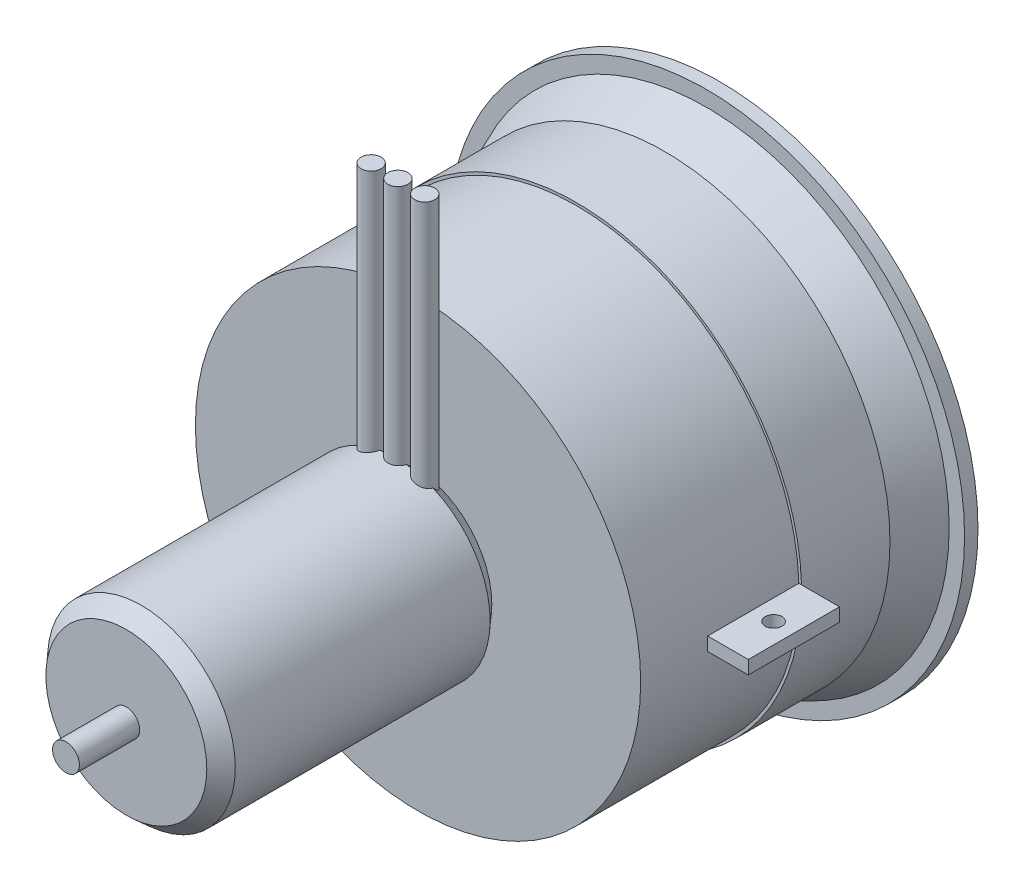
from build123d import *

# Parameters (mm, degrees)
SKETCH3_W           = 2
SKETCH3_H           = 13.6
BOSS_EXTRUDE1_DEPTH = 39.25
SKETCH4_R           = 1.25
CUT_EXTRUDE1_DEPTH  = 113.281176072
SKETCH5_R           = 1.5
BOSS_EXTRUDE5_DEPTH = 50


with BuildPart() as part:
    # Sketch1 → Revolve1 (revolve)
    with BuildSketch(Plane.YZ):
        Polygon((0, 0), (38.5, 0), (38.5, 2), (36.2, 2), (33.6, 8.225), (33.6, 21.4), (33.2, 21.4), (33.2, 45), (5, 45), (5, 46), (12, 46), (14, 48.25), (14, 86.25), (12, 88.5), (2, 88.5), (2, 97.5), (0, 97.5), align=None)
    revolve(axis=Axis((0, 0, 0), (0, 0, -1)))

    # Sketch3 → Boss-Extrude1 (add, symmetric)
    with BuildSketch(Plane.YZ):
        with Locations((0, 28.2)):
            Rectangle(SKETCH3_W, SKETCH3_H)
    extrude(amount=BOSS_EXTRUDE1_DEPTH, both=True)

    # Sketch4 → Cut-Extrude1 (cut, through all)
    with BuildSketch(Plane(origin=(0, 1, 0), x_dir=(-1, 0, 0), z_dir=(0, 1, 0))):
        with Locations((-36.217468171, 28.2)):
            Circle(SKETCH4_R)
    cut_extrude1 = extrude(amount=-CUT_EXTRUDE1_DEPTH, mode=Mode.SUBTRACT)

    # Mirror1: Cut-Extrude1 across plane
    add(cut_extrude1.mirror(Plane(origin=(0, 0, 0), x_dir=(0, 0, 1), z_dir=(1, 0, 0))), mode=Mode.SUBTRACT)

    # Sketch5 → Boss-Extrude5 (add)
    with BuildSketch(Plane(origin=(0, 0, 0), x_dir=(-1, 0, 0), z_dir=(0, 1, 0))):
        with Locations((0, 48)):
            Circle(SKETCH5_R)
        with Locations((4, 48)):
            Circle(SKETCH5_R)
        with Locations((-4, 48)):
            Circle(SKETCH5_R)
    extrude(amount=BOSS_EXTRUDE5_DEPTH)


solid = part.part
